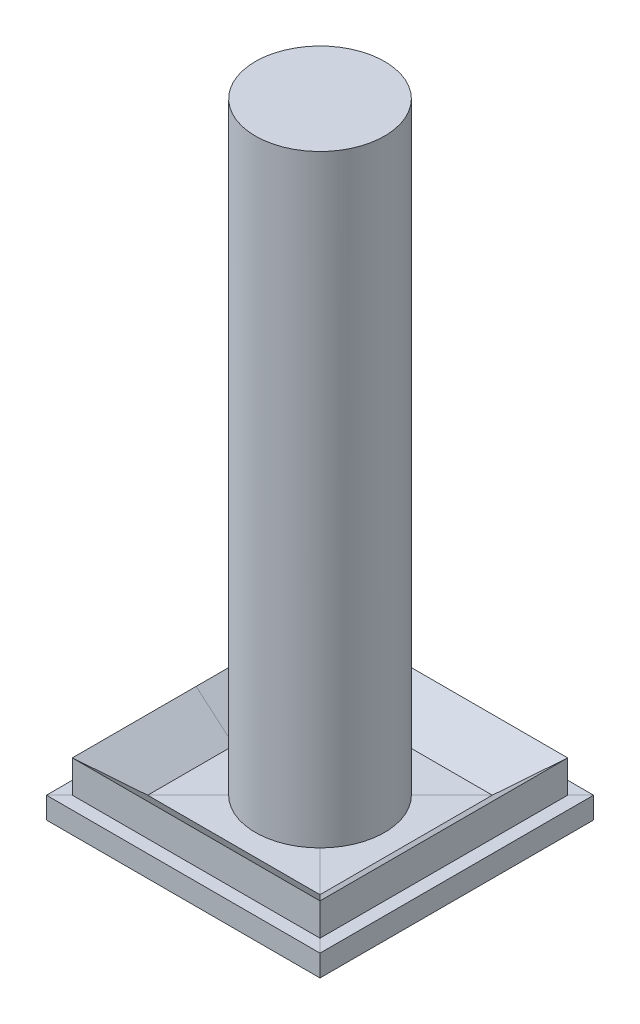
from build123d import *

# Parameters (mm, degrees)
SWEEP1_START        = -11.5
SWEEP1_DEPTH        = 23
SWEEP1_START_2      = -12.7
SWEEP1_2_OUTLINE_W  = 25.4
SWEEP1_2_OUTLINE_H  = 2
SWEEP1_2_DEPTH      = 25.4
SWEEP1_3_DEPTH      = 23
SKETCH3_R           = 6
BOSS_EXTRUDE1_DEPTH = 58


with BuildPart() as part:
    # Sweep1: read off the stored shape, not the designer's step
    # Sweep1 outline → Sweep1 (new body)
    with BuildSketch(Plane.XY.offset(SWEEP1_START)):
        Polygon((12.7, 0), (12.7, 2), (11.5, 2), (11.5, 5), (8, 2), (-8, 2), (-11.5, 5), (-11.5, 2), (-12.7, 2), (-12.7, 0), align=None)
    extrude(amount=SWEEP1_DEPTH)



with BuildPart() as body_2:
    # Sweep1 2 outline → Sweep1 2 (new body)
    with BuildSketch(Plane.XY.offset(SWEEP1_START_2)):
        with Locations((0, 1)):
            Rectangle(SWEEP1_2_OUTLINE_W, SWEEP1_2_OUTLINE_H)
    extrude(amount=SWEEP1_2_DEPTH)


with BuildPart() as part_1:
    add(part.part)

    add(body_2.part)  # Sweep1 3 merges body 2
    # Sweep1 3 outline → Sweep1 3 (add)
    with BuildSketch(Plane.YZ.offset(SWEEP1_START)):
        Polygon((5, -11.5), (2, -8), (2, -11.5), align=None)
        Polygon((5, 11.5), (2, 11.5), (2, 8), align=None)
    extrude(amount=SWEEP1_3_DEPTH)

    # Sketch3 → Boss-Extrude1 (add)
    with BuildSketch(Plane(origin=(0, 0, 0), x_dir=(1, 0, 0), z_dir=(0, 1, 0))):
        with Locations(Location((0, 0, 0), (0, 0, 45))):
            Circle(SKETCH3_R)
    extrude(amount=BOSS_EXTRUDE1_DEPTH)


solid = part_1.part
